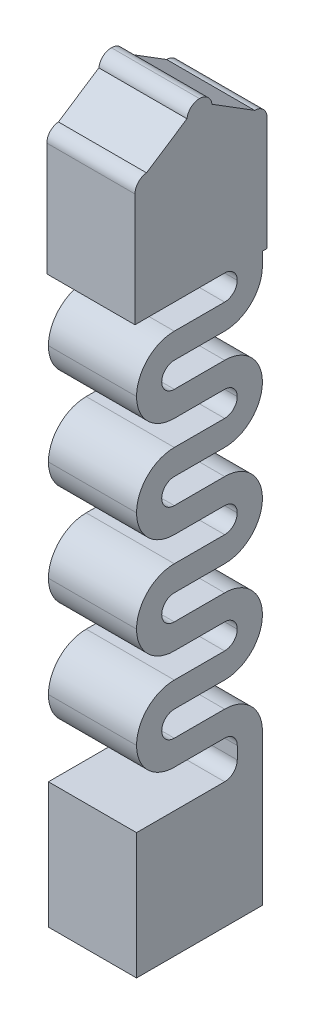
from build123d import *

# Parameters (mm, degrees)
AUFSATZ_LINEAR_AUSTRAGEN3_DEPTH = 2.8
VERRUNDUNG2_R                   = 0.4
VERRUNDUNG5_R                   = 1.2
VERRUNDUNG6_R                   = 1.2
LINEARES_MUSTER1_COUNT          = 5
LINEARES_MUSTER1_PITCH          = 3.2
SKIZZE5_W                       = 4
SKIZZE5_H                       = 4
SKIZZE5_W_2                     = 4.2
AUFSATZ_LINEAR_AUSTRAGEN4_DEPTH = 2.8
VERRUNDUNG3_R                   = 0.4
VERRUNDUNG4_R                   = 0.4
VERRUNDUNG8_R                   = 1.2
FASE1_START                     = 84.3
FASE1_DEPTH                     = 2.8


with BuildPart() as part:
    # Aufsatz-Linear austragen3: read off the stored shape, not the designer's step
    # Aufsatz-Linear austragen3 outline → Aufsatz-Linear austragen3 (new body)
    with BuildSketch(Plane(origin=(84.3, 0, 0), x_dir=(0, 0, -1), z_dir=(1, 0, 0))):
        Polygon((11.9, 5.1), (11.9, 6.3), (11.1, 6.3), (11.1, 4.3), (12.7, 4.3), (12.7, 3.5), (9.5, 3.5), (9.5, 1.1), (12.7, 1.1), (12.7, -0.1), (13.5, -0.1), (13.5, 1.9), (10.3, 1.9), (10.3, 2.7), (13.5, 2.7), (13.5, 5.1), align=None)
    extrude(amount=AUFSATZ_LINEAR_AUSTRAGEN3_DEPTH)

    # Verrundung2
    verrundung2_edges = [part.edges().sort_by_distance(p)[0] for p in [
        (85.7, 1.9, -10.3),
        (85.7, 2.7, -10.3),
        (85.7, 3.5, -12.7),
        (85.7, 4.3, -12.7),
        (85.7, 6.3, -11.1),
        (85.7, 6.3, -11.9),
        (85.7, 1.1, -12.7),
    ]]
    fillet(verrundung2_edges, radius=VERRUNDUNG2_R - 0.0001)  # a hair under: the kernel refuses the full size


with BuildPart() as body_2:
    # Abspalten1: the piece on the far side of the plane
    add(part.part)
    split(bisect_by=Plane.ZX.offset(3.5), keep=Keep.BOTTOM)

    # Verrundung5
    verrundung5_edges = [body_2.edges().sort_by_distance(p)[0] for p in [
        (85.7, 1.1, -9.5),
        (85.7, 3.5, -9.5),
    ]]
    fillet(verrundung5_edges, radius=VERRUNDUNG5_R - 0.0001)  # a hair under: the kernel refuses the full size


with BuildPart() as part_1:
    add(part.part)

    # Abspalten1
    split(bisect_by=Plane.ZX.offset(3.5), keep=Keep.TOP)

    # Verrundung6
    verrundung6_edges = [part_1.edges().sort_by_distance(p)[0] for p in [
        (85.7, 5.1, -13.5),
    ]]
    fillet(verrundung6_edges, radius=VERRUNDUNG6_R)


with BuildPart() as lineares_muster1_1:
    # Lineares Muster1: pattern copy
    add(body_2.part.moved(Location(Vector(0, -1, 0) * (1 * LINEARES_MUSTER1_PITCH))))


with BuildPart() as lineares_muster1_2:
    # Lineares Muster1: pattern copy
    add(body_2.part.moved(Location(Vector(0, -1, 0) * (2 * LINEARES_MUSTER1_PITCH))))


with BuildPart() as lineares_muster1_3:
    # Lineares Muster1: pattern copy
    add(body_2.part.moved(Location(Vector(0, -1, 0) * (3 * LINEARES_MUSTER1_PITCH))))


with BuildPart() as lineares_muster1_4:
    # Lineares Muster1: pattern copy
    add(body_2.part.moved(Location(Vector(0, -1, 0) * (4 * LINEARES_MUSTER1_PITCH))))

    # Skizze5 → Aufsatz-Linear austragen4 (add)
    with BuildSketch(Plane(origin=(84.3, 0, 0), x_dir=(0, 0, -1), z_dir=(1, 0, 0))):
        with Locations((11.5, -14.9)):
            Rectangle(SKIZZE5_W, SKIZZE5_H)
        with Locations((11.55, 3.1)):
            Rectangle(SKIZZE5_W_2, SKIZZE5_H)
    extrude(amount=AUFSATZ_LINEAR_AUSTRAGEN4_DEPTH)


with BuildPart() as aufsatz_linear_austragen4_piece_1:
    # of the separate pieces the step leaves, piece 1, a body of its own (aufsatz_linear_austragen4_pieces)
    add(lineares_muster1_4.part.solids().sort_by_distance((84.3, -9.3, -10.6999))[0])

    # Verrundung3
    verrundung3_edges = [aufsatz_linear_austragen4_piece_1.edges().sort_by_distance(p)[0] for p in [
        (85.7, -12.9, -12.7),
    ]]
    fillet(verrundung3_edges, radius=VERRUNDUNG3_R)


with BuildPart() as aufsatz_linear_austragen4_piece_2:
    # of the separate pieces the step leaves, piece 2, a body of its own (aufsatz_linear_austragen4_pieces)
    add(lineares_muster1_4.part.solids().sort_by_distance((84.3, 1.1, -9.45))[0])


with BuildPart() as part_2:
    add(part_1.part)

    # Kombinieren1: union body 2, Lineares Muster1_1, Lineares Muster1_2, Lineares Muster1_3, Aufsatz-Linear austragen4 piece 1, Aufsatz-Linear austragen4 piece 2
    add(body_2.part)
    add(lineares_muster1_1.part)
    add(lineares_muster1_2.part)
    add(lineares_muster1_3.part)
    add(aufsatz_linear_austragen4_piece_1.part)
    add(aufsatz_linear_austragen4_piece_2.part)

    # Verrundung4
    verrundung4_edges = [part_2.edges().sort_by_distance(p)[0] for p in [
        (85.7, -9.3, -12.7),
        (85.7, -6.1, -12.7),
        (85.7, -2.9, -12.7),
        (85.7, 0.3, -12.7),
        (85.7, 5.1, -9.45),
        (85.7, 5.1, -13.65),
    ]]
    fillet(verrundung4_edges, radius=VERRUNDUNG4_R)

    # Verrundung8
    verrundung8_edges = [part_2.edges().sort_by_distance(p)[0] for p in [
        (85.7, -0.5, -13.5),
        (85.7, -3.7, -13.5),
        (85.7, -1.3, -13.5),
        (85.7, -6.9, -13.5),
        (85.7, -4.5, -13.5),
        (85.7, -10.1, -13.5),
        (85.7, -7.7, -13.5),
        (85.7, -10.9, -13.5),
    ]]
    fillet(verrundung8_edges, radius=VERRUNDUNG8_R - 0.0001)  # a hair under: the kernel refuses the full size

    # Fase1: read off the stored shape, not the designer's step
    # Fase1 outline → Fase1 (add)
    with BuildSketch(Plane.YZ.offset(FASE1_START)):
        with BuildLine():
            ThreePointArc((5.9, -11.1), (5.922012566, -11.100606151), (5.943958417, -11.102422765))
            Line((5.943958417, -11.102422765), (5.098633526, -9.816964992))
            ThreePointArc((5.098633526, -9.816964992), (5.099658235, -9.833468371), (5.1, -9.85))
            Line((5.1, -9.85), (5.1, -11.1))
            Line((5.1, -11.1), (5.9, -11.1))
        make_face()
        with BuildLine():
            Line((5.099976744, -13.254313255), (5.945017032, -11.897458761))
            ThreePointArc((5.945017032, -11.897458761), (5.922544351, -11.899364185), (5.9, -11.9))
            Line((5.9, -11.9), (5.1, -11.9))
            Line((5.1, -11.9), (5.1, -13.25))
            ThreePointArc((5.1, -13.25), (5.099994186, -13.252156659), (5.099976744, -13.254313255))
        make_face()
    extrude(amount=FASE1_DEPTH)


solid = part_2.part
